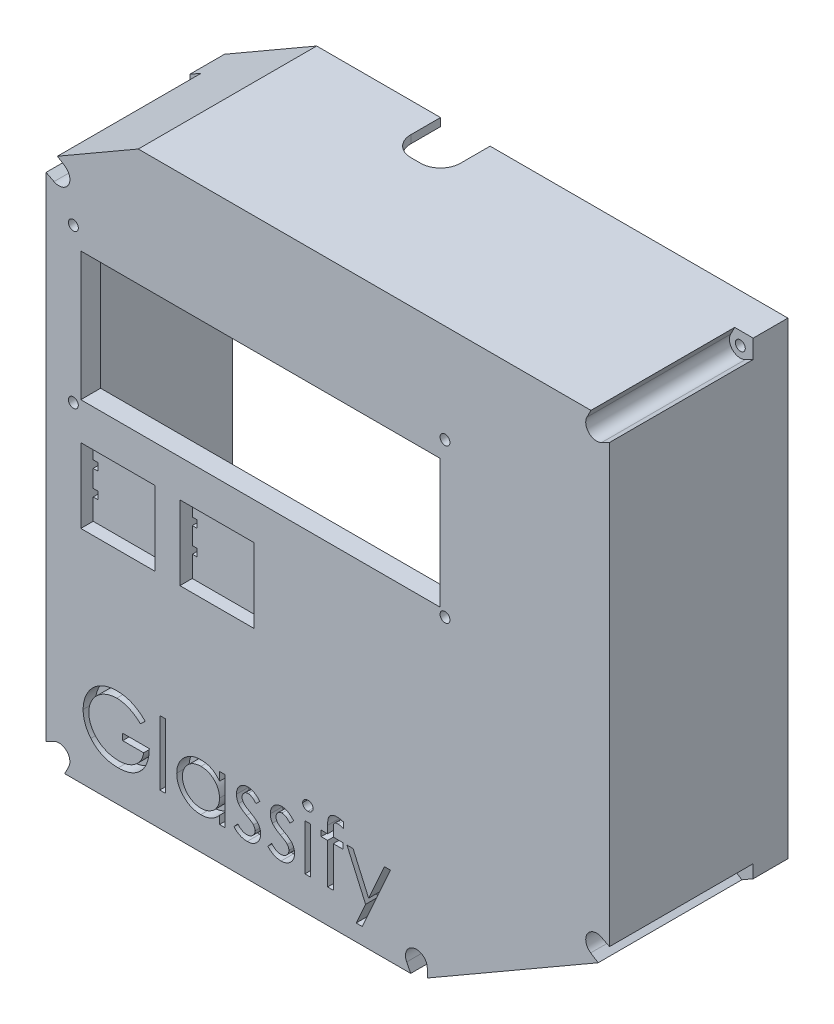
from build123d import *

# Parameters (mm, degrees)
SKETCH1_R                = 1
BOSS_EXTRUDE1_DEPTH      = 32
BOSS_EXTRUDE2_DEPTH      = 4
SKETCH4_W                = 72.5
SKETCH4_H                = 26
CUT_EXTRUDE1_DEPTH       = 4
SKETCH5_R                = 1
CUT_EXTRUDE2_DEPTH       = 4
FILLET2_SIZE             = 30
FILLET2_SIZE_2           = 2.5
CUT_EXTRUDE4_START       = -29
SKETCH8_R                = 1
CUT_EXTRUDE4_DEPTH       = 29
SKETCH8_4_W              = 1.13974359
SKETCH8_4_H              = 13.025641026
SKETCH8_4_H_2            = 9.280769231
CUT_EXTRUDE11_DEPTH      = 2.5
SKETCH9_W                = 15
SKETCH9_H                = 15
CUT_EXTRUDE6_DEPTH       = 2.5
CUT_EXTRUDE7_DEPTH       = 296.947520815
CUT_EXTRUDE7_DEPTH_BACK  = 296.947520815
SKETCH10_W               = 1
SKETCH10_H               = 1.5
CUT_EXTRUDE8_DEPTH       = 312.024520878
CUT_EXTRUDE8_DEPTH_BACK  = 1.6
CUT_EXTRUDE9_DEPTH       = 1.6
CUT_EXTRUDE10_DEPTH      = 1.6
CUT_EXTRUDE12_DEPTH      = 297.240924042
CUT_EXTRUDE12_DEPTH_BACK = 297.240924042
SKETCH14_R               = 1


with BuildPart() as part:
    # Sketch1 → Boss-Extrude1 (new body)
    with BuildSketch(Plane.XY):
        Polygon((62.85, 287.25), (-32.25, 287.25), (-50.85, 276.511284993), (-50.85, 170.65), (24.571677153, 170.65), (62.85, 192.75), align=None)
        with Locations((-48.25, 173.25)):
            Circle(SKETCH1_R, mode=Mode.SUBTRACT)
        with Locations((-48.25, 275.010174293)):
            Circle(SKETCH1_R, mode=Mode.SUBTRACT)
        with Locations((60.25, 194.2511107)):
            Circle(SKETCH1_R, mode=Mode.SUBTRACT)
        with Locations((60.25, 284.65)):
            Circle(SKETCH1_R, mode=Mode.SUBTRACT)
        with Locations((23.875009252, 173.25)):
            Circle(SKETCH1_R, mode=Mode.SUBTRACT)
        with BuildLine():
            Line((-33.750388375, 284.536229507), (-31.821281292, 285.65))
            Line((-31.821281292, 285.65), (-29.593740305, 285.65))
            Line((-29.593740305, 285.65), (58.290408206, 285.65))
            ThreePointArc((58.290408206, 285.65), (58.694365081, 283.094365081), (61.25, 282.690408206))
            Line((61.25, 282.690408206), (61.25, 196.210702494))
            ThreePointArc((61.25, 196.210702494), (58.344744112, 195.3511107), (59.052943725, 192.405289399))
            Line((59.052943725, 192.405289399), (26.072065527, 173.363770493))
            ThreePointArc((26.072065527, 173.363770493), (23.305607353, 175.375036818), (21.915417458, 172.25))
            Line((21.915417458, 172.25), (-46.290408206, 172.25))
            ThreePointArc((-46.290408206, 172.25), (-46.694365081, 174.805634919), (-49.25, 175.209591794))
            Line((-49.25, 175.209591794), (-49.25, 273.050582499))
            ThreePointArc((-49.25, 273.050582499), (-46.344744112, 273.910174293), (-47.052943725, 276.855995594))
            Line((-47.052943725, 276.855995594), (-33.750388375, 284.536229507))
        make_face(mode=Mode.SUBTRACT)
    extrude(amount=BOSS_EXTRUDE1_DEPTH)

    # Sketch2 → Boss-Extrude2 (add)
    with BuildSketch(Plane.XY.offset(32)):
        Polygon((24.571677153, 170.65), (62.85, 192.75), (62.85, 287.25), (-32.25, 287.25), (-50.85, 276.511284993), (-50.85, 170.65), align=None)
    extrude(amount=BOSS_EXTRUDE2_DEPTH)

    # Sketch4 → Cut-Extrude1 (cut)
    with BuildSketch(Plane(origin=(0, 0, 32), x_dir=(-1, 0, 0), z_dir=(0, 0, -1))):
        with Locations((7.6, 250.634259992)):
            Rectangle(SKETCH4_W, SKETCH4_H)
    extrude(amount=-CUT_EXTRUDE1_DEPTH, mode=Mode.SUBTRACT)

    # Sketch5 → Cut-Extrude2 (cut)
    with BuildSketch(Plane(origin=(0, 0, 32), x_dir=(-1, 0, 0), z_dir=(0, 0, -1))):
        with Locations((45.35, 267.384259992)):
            Circle(SKETCH5_R)
        with Locations((45.35, 236.384259992)):
            Circle(SKETCH5_R)
        with Locations((-29.65, 267.384259992)):
            Circle(SKETCH5_R)
        with Locations((-29.65, 236.384259992)):
            Circle(SKETCH5_R)
    extrude(amount=-CUT_EXTRUDE2_DEPTH, mode=Mode.SUBTRACT)

    # Fillet2
    # an asymmetric fillet: 30, 2.5 mm, written as the material it adds along each edge
    with BuildSketch(Plane(origin=(60.25, 284.65, 32), x_dir=(0.7048818539423529, 0.7093247295722822, 0), z_dir=(0.7093247295722822, -0.7048818539423529, 0))) as fillet2_piece_1_section:
        with BuildLine():
            Bezier((2.2, -FILLET2_SIZE), (2.2, 0), (2.2 + FILLET2_SIZE_2, 0), weights=[1, 0.707106781, 1])
            Line((2.2 + FILLET2_SIZE_2, 0), (2.2, 0))
            Line((2.2, 0), (2.2, -FILLET2_SIZE))
        make_face()
    fillet2_piece_1 = revolve(axis=Axis((60.25, 284.65, 32), (0, 0, 1)), revolution_arc=359.64, mode=Mode.PRIVATE)
    fillet2_piece_1 = split(fillet2_piece_1, bisect_by=Plane(origin=(58.672903234, 285.65, 25.67208435), z_dir=(0, -1, 0)), keep=Keep.TOP, mode=Mode.PRIVATE)
    fillet2_piece_1 = split(fillet2_piece_1, bisect_by=Plane(origin=(61.25, 283.072893763, 25.67208435), z_dir=(-1, 0, 0)), keep=Keep.TOP, mode=Mode.PRIVATE)
    add(fillet2_piece_1)
    with BuildSketch(Plane(origin=(23.875009252, 173.25, 32), x_dir=(0.2618523083709333, -0.9651079569668948, 0), z_dir=(-0.9651079569668948, -0.2618523083709333, 0))) as fillet2_piece_2_section:
        with BuildLine():
            Bezier((2.2, -FILLET2_SIZE), (2.2, 0), (2.2 + FILLET2_SIZE_2, 0), weights=[1, 0.707106781, 1])
            Line((2.2 + FILLET2_SIZE_2, 0), (2.2, 0))
            Line((2.2, 0), (2.2, -FILLET2_SIZE))
        make_face()
    fillet2_piece_2 = revolve(axis=Axis((23.875009252, 173.25, 32), (0, 0, 1)), revolution_arc=359.64, mode=Mode.PRIVATE)
    fillet2_piece_2 = split(fillet2_piece_2, bisect_by=Plane(origin=(23.129772547, 172.25, 23.217608396), z_dir=(0, 1, 0)), keep=Keep.TOP, mode=Mode.PRIVATE)
    fillet2_piece_2 = split(fillet2_piece_2, bisect_by=Plane(origin=(25.020403171, 172.756592949, 23.217608396), z_dir=(-0.500000000000001, 0.8660254037844382, 0)), keep=Keep.TOP, mode=Mode.PRIVATE)
    add(fillet2_piece_2)
    with BuildSketch(Plane(origin=(60.25, 194.2511107, 32), x_dir=(0.867591923866824, -0.49727683802994777, 0), z_dir=(-0.49727683802994777, -0.867591923866824, 0))) as fillet2_piece_3_section:
        with BuildLine():
            Bezier((2.2, -FILLET2_SIZE), (2.2, 0), (2.2 + FILLET2_SIZE_2, 0), weights=[1, 0.707106781, 1])
            Line((2.2 + FILLET2_SIZE_2, 0), (2.2, 0))
            Line((2.2, 0), (2.2, -FILLET2_SIZE))
        make_face()
    fillet2_piece_3 = revolve(axis=Axis((60.25, 194.2511107, 32), (0, 0, 1)), revolution_arc=359.64, mode=Mode.PRIVATE)
    fillet2_piece_3 = split(fillet2_piece_3, bisect_by=Plane(origin=(61.25, 195.692247899, 23.217366656), z_dir=(-1, 0, 0)), keep=Keep.TOP, mode=Mode.PRIVATE)
    fillet2_piece_3 = split(fillet2_piece_3, bisect_by=Plane(origin=(59.501938575, 192.664516696, 23.217366656), z_dir=(-0.500000000000001, 0.8660254037844382, 0)), keep=Keep.TOP, mode=Mode.PRIVATE)
    add(fillet2_piece_3)
    with BuildSketch(Plane(origin=(-48.25, 173.25, 32), x_dir=(-0.7048818539423642, -0.7093247295722711, 0), z_dir=(-0.7093247295722711, 0.7048818539423642, 0))) as fillet2_piece_4_section:
        with BuildLine():
            Bezier((2.2, -FILLET2_SIZE), (2.2, 0), (2.2 + FILLET2_SIZE_2, 0), weights=[1, 0.707106781, 1])
            Line((2.2 + FILLET2_SIZE_2, 0), (2.2, 0))
            Line((2.2, 0), (2.2, -FILLET2_SIZE))
        make_face()
    fillet2_piece_4 = revolve(axis=Axis((-48.25, 173.25, 32), (0, 0, 1)), revolution_arc=359.64, mode=Mode.PRIVATE)
    fillet2_piece_4 = split(fillet2_piece_4, bisect_by=Plane(origin=(-46.672903234, 172.25, 25.67208435), z_dir=(0, 1, 0)), keep=Keep.TOP, mode=Mode.PRIVATE)
    fillet2_piece_4 = split(fillet2_piece_4, bisect_by=Plane(origin=(-49.25, 174.827106237, 25.67208435), z_dir=(1, 0, 0)), keep=Keep.TOP, mode=Mode.PRIVATE)
    add(fillet2_piece_4)
    with BuildSketch(Plane(origin=(-48.25, 275.010174293, 32), x_dir=(-0.8675919238668233, 0.49727683802994915, 0), z_dir=(0.49727683802994915, 0.8675919238668233, 0))) as fillet2_piece_5_section:
        with BuildLine():
            Bezier((2.2, -FILLET2_SIZE), (2.2, 0), (2.2 + FILLET2_SIZE_2, 0), weights=[1, 0.707106781, 1])
            Line((2.2 + FILLET2_SIZE_2, 0), (2.2, 0))
            Line((2.2, 0), (2.2, -FILLET2_SIZE))
        make_face()
    fillet2_piece_5 = revolve(axis=Axis((-48.25, 275.010174293, 32), (0, 0, 1)), revolution_arc=359.64, mode=Mode.PRIVATE)
    fillet2_piece_5 = split(fillet2_piece_5, bisect_by=Plane(origin=(-49.25, 273.569037094, 23.217366656), z_dir=(1, 0, 0)), keep=Keep.TOP, mode=Mode.PRIVATE)
    fillet2_piece_5 = split(fillet2_piece_5, bisect_by=Plane(origin=(-47.501938575, 276.596768297, 23.217366656), z_dir=(0.5000000000000029, -0.866025403784437, 0)), keep=Keep.TOP, mode=Mode.PRIVATE)
    add(fillet2_piece_5)

    # Sketch8 → Cut-Extrude4 (cut)
    # profile 1 of 5: a face of its own
    with BuildSketch(Plane.XY.offset(36).offset(CUT_EXTRUDE4_START)):
        with BuildLine():
            Line((26.164958746, 171.569881557), (26.072065527, 173.363770493))
            ThreePointArc((26.072065527, 173.363770493), (23.305607353, 175.375036818), (21.915417458, 172.25))
            Line((21.915417458, 172.25), (22.731914039, 170.65))
            Line((22.731914039, 170.65), (24.571677153, 170.65))
            Line((24.571677153, 170.65), (26.164958746, 171.569881557))
        make_face()
        with Locations((23.875009252, 173.25)):
            Circle(SKETCH8_R, mode=Mode.SUBTRACT)
    # profile 2 of 5: a face of its own
    with BuildSketch(Plane.XY.offset(36).offset(CUT_EXTRUDE4_START)):
        with BuildLine():
            ThreePointArc((-49.25, 273.050582499), (-46.344744112, 273.910174293), (-47.052943725, 276.855995594))
            Line((-47.052943725, 276.855995594), (-48.560050506, 277.83338795))
            Line((-48.560050506, 277.83338795), (-50.85, 276.511284993))
            Line((-50.85, 276.511284993), (-50.85, 273.86707908))
            Line((-50.85, 273.86707908), (-49.25, 273.050582499))
        make_face()
        with Locations((-48.25, 275.010174293)):
            Circle(SKETCH8_R, mode=Mode.SUBTRACT)
    # profile 3 of 5: a face of its own
    with BuildSketch(Plane.XY.offset(36).offset(CUT_EXTRUDE4_START)):
        with BuildLine():
            Line((62.85, 195.394205913), (61.25, 196.210702494))
            ThreePointArc((61.25, 196.210702494), (58.344744112, 195.3511107), (59.052943725, 192.405289399))
            Line((59.052943725, 192.405289399), (60.560050506, 191.427897043))
            Line((60.560050506, 191.427897043), (62.85, 192.75))
            Line((62.85, 192.75), (62.85, 195.394205913))
        make_face()
        with Locations((60.25, 194.2511107)):
            Circle(SKETCH8_R, mode=Mode.SUBTRACT)
    # profile 4 of 5: a face of its own
    with BuildSketch(Plane.XY.offset(36).offset(CUT_EXTRUDE4_START)):
        with BuildLine():
            Line((-47.106904787, 170.65), (-50.85, 170.65))
            Line((-50.85, 170.65), (-50.85, 174.393095213))
            Line((-50.85, 174.393095213), (-49.25, 175.209591794))
            ThreePointArc((-49.25, 175.209591794), (-46.694365081, 174.805634919), (-46.290408206, 172.25))
            Line((-46.290408206, 172.25), (-47.106904787, 170.65))
        make_face()
    # profile 5 of 5: a face of its own
    with BuildSketch(Plane.XY.offset(36).offset(CUT_EXTRUDE4_START)):
        with BuildLine():
            Line((62.85, 287.25), (62.85, 283.506904787))
            Line((62.85, 283.506904787), (61.25, 282.690408206))
            ThreePointArc((61.25, 282.690408206), (58.694365081, 283.094365081), (58.290408206, 285.65))
            Line((58.290408206, 285.65), (59.106904787, 287.25))
            Line((59.106904787, 287.25), (62.85, 287.25))
        make_face()
    extrude(amount=CUT_EXTRUDE4_DEPTH, mode=Mode.SUBTRACT)


with BuildPart() as cut_extrude4_piece_1:
    # of the separate pieces the step leaves, piece 1, a body of its own (cut_extrude4_pieces)
    add(part.part.solids().sort_by_distance((-49.25, 273.050582499, 2))[0])

    # Sketch8<4> → Cut-Extrude11 (cut)
    # profile 1 of 9: a face of its own
    with BuildSketch(Plane.XY.offset(36)):
        with BuildLine():
            Line((-31.814392065, 186.988858523), (-30.837468988, 187.914900189))
            add(Edge.make_bspline(
                [(-36.543819148, 190.408089292), (-36.412326092, 190.405986565), (-36.151590815, 190.401817104), (-35.763603158, 190.372916809), (-35.381612505, 190.327110155), (-35.005052461, 190.26460153), (-34.635205361, 190.179461853), (-34.271017601, 190.077577791), (-33.911961256, 189.958953178), (-33.559161609, 189.817479364), (-33.210246468, 189.656901925), (-32.863275789, 189.476150364), (-32.519435097, 189.272133918), (-32.178128107, 189.044246804), (-31.837202566, 188.796402973), (-31.502050863, 188.521513927), (-31.164583037, 188.230419927), (-30.947587883, 188.021116003), (-30.837468988, 187.914900189)],
                knots=[0, 0, 0, 0, 0.985871117, 1.954866573, 2.915460327, 3.869826059, 4.81536089, 5.759505086, 6.70452669, 7.649098992, 8.607881297, 9.583363685, 10.581137262, 11.603961102, 12.659522466, 13.73993555, 14.853081303, 16, 16, 16, 16], degree=3))
            add(Edge.make_bspline(
                [(-43.374648475, 183.737536407), (-43.372717211, 183.886911096), (-43.368879228, 184.183762011), (-43.322340926, 184.624478527), (-43.255570067, 185.05736961), (-43.157427897, 185.4820814), (-43.033707165, 185.898897547), (-42.879298802, 186.308011587), (-42.699521608, 186.70966495), (-42.490568522, 187.101092985), (-42.258033483, 187.477101569), (-42.005665541, 187.836177027), (-41.729881048, 188.171780206), (-41.435183719, 188.488161329), (-41.118057497, 188.781345717), (-40.781473302, 189.054047776), (-40.425171744, 189.306633307), (-40.048031891, 189.53512385), (-39.655682865, 189.740368987), (-39.249065145, 189.920306984), (-38.828302857, 190.069017872), (-38.396548295, 190.195197015), (-37.950533364, 190.288506239), (-37.493494702, 190.356174544), (-37.02305001, 190.402477291), (-36.705056418, 190.406201134), (-36.543819148, 190.408089292)],
                knots=[0, 0, 0, 0, 1.008945113, 2.00506715, 2.99143336, 3.967273523, 4.948097931, 5.927297278, 6.919902385, 7.919676788, 8.923139349, 9.905703106, 10.883022732, 11.856032218, 12.825136022, 13.798837087, 14.781400844, 15.773989409, 16.776158564, 17.77167057, 18.775803737, 19.789618931, 20.80898985, 21.851988756, 22.910860228, 24, 24, 24, 24], degree=3))
            add(Edge.make_bspline(
                [(-41.817677321, 179.458409805), (-41.941723417, 179.613243317), (-42.187756571, 179.920340265), (-42.504451597, 180.412374349), (-42.774422401, 180.921832528), (-42.993471356, 181.450133036), (-43.164515269, 181.996781723), (-43.287183672, 182.561080065), (-43.359055836, 183.143754725), (-43.3694101, 183.538054399), (-43.374648475, 183.737536407)],
                knots=[0, 0, 0, 0, 1.023165419, 2.029347347, 3.013907458, 3.994755782, 4.975994455, 5.96558838, 6.970761222, 8, 8, 8, 8], degree=3))
            add(Edge.make_bspline(
                [(-36.314852802, 177.056807241), (-36.45821815, 177.058872338), (-36.740980823, 177.062945375), (-37.158596476, 177.09189175), (-37.564697556, 177.136452698), (-37.959224903, 177.203745003), (-38.343629745, 177.286166748), (-38.715992238, 177.391709985), (-39.077730845, 177.513879265), (-39.429404679, 177.652837852), (-39.767821749, 177.813843578), (-40.094489396, 177.992767127), (-40.411213338, 178.188685893), (-40.715836137, 178.404988104), (-41.009944992, 178.640055888), (-41.291643487, 178.894360394), (-41.562508645, 179.167124172), (-41.732182327, 179.360813721), (-41.817677321, 179.458409805)],
                knots=[0, 0, 0, 0, 1.107784379, 2.184907829, 3.233506516, 4.263428166, 5.276301166, 6.270063455, 7.25232949, 8.225834625, 9.190232166, 10.146266622, 11.1027726, 12.066435141, 13.031522626, 14.010570082, 14.99756817, 16, 16, 16, 16], degree=3))
            add(Edge.make_bspline(
                [(-30.023366423, 183.569627754), (-30.029556216, 183.326849151), (-30.041670759, 182.851687571), (-30.126647967, 182.158738303), (-30.263867883, 181.50424673), (-30.451321014, 180.887523584), (-30.693982746, 180.309442833), (-30.989248778, 179.769417547), (-31.34184476, 179.270936448), (-31.739211219, 178.809930064), (-32.185162494, 178.398706923), (-32.66764863, 178.037279662), (-33.187466772, 177.732833029), (-33.744125216, 177.48514434), (-34.335801646, 177.291835844), (-34.963865196, 177.15477898), (-35.627464147, 177.072664542), (-36.082257231, 177.062172965), (-36.314852802, 177.056807241)],
                knots=[0, 0, 0, 0, 1.140356446, 2.231883559, 3.274166699, 4.278491846, 5.25512956, 6.21435461, 7.1637429, 8.11826594, 9.068280886, 10.0076534, 10.945064095, 11.891975133, 12.864533718, 13.863980011, 14.907571808, 16, 16, 16, 16], degree=3))
            Line((-30.023366423, 183.569627754), (-35.396443347, 183.569627754))
            Line((-35.396443347, 183.569627754), (-35.396443347, 182.267063651))
            Line((-35.396443347, 182.267063651), (-31.163110013, 182.267063651))
            add(Edge.make_bspline(
                [(-36.215634052, 178.359371343), (-36.050975477, 178.36281332), (-35.727641615, 178.369572201), (-35.252347952, 178.422187537), (-34.795862524, 178.504363045), (-34.359468015, 178.62470787), (-33.942657568, 178.778209777), (-33.543903181, 178.963250179), (-33.166344305, 179.186926422), (-32.808845933, 179.439380168), (-32.479527003, 179.720648275), (-32.182513467, 180.024158155), (-31.922542692, 180.348436568), (-31.695739926, 180.691573569), (-31.50811138, 181.05640939), (-31.354104666, 181.441156117), (-31.236055294, 181.845986803), (-31.187595814, 182.125719296), (-31.163110013, 182.267063651)],
                knots=[0, 0, 0, 0, 1.13008108, 2.219097802, 3.278683437, 4.311054135, 5.322181354, 6.324827112, 7.324222904, 8.330512327, 9.32562643, 10.293043162, 11.24128371, 12.174520618, 13.111833804, 14.052305215, 15.015860969, 16, 16, 16, 16], degree=3))
            add(Edge.make_bspline(
                [(-42.234904885, 183.788417818), (-42.232162707, 183.671320852), (-42.22668584, 183.437446674), (-42.19163268, 183.088399611), (-42.126578779, 182.744536579), (-42.039610236, 182.404727639), (-41.930822705, 182.068390826), (-41.795213316, 181.73698429), (-41.634592423, 181.410520299), (-41.448676934, 181.091940375), (-41.244801281, 180.781613976), (-41.016407816, 180.489297997), (-40.773799413, 180.211099862), (-40.508137548, 179.953196376), (-40.227940924, 179.708689095), (-39.924838093, 179.484314487), (-39.604789165, 179.275750648), (-39.267305854, 179.085626135), (-38.916050043, 178.91577802), (-38.555889825, 178.76474274), (-38.185674608, 178.640357716), (-37.807349992, 178.53898231), (-37.421366977, 178.455886946), (-37.025766322, 178.402429089), (-36.62345678, 178.363636645), (-36.352262315, 178.360800299), (-36.215634052, 178.359371343)],
                knots=[0, 0, 0, 0, 0.93586088, 1.869166235, 2.799637598, 3.729985548, 4.670839027, 5.622275134, 6.589130586, 7.576015415, 8.568469353, 9.55398029, 10.53834874, 11.515998671, 12.510579167, 13.508179873, 14.527009472, 15.561807829, 16.601455013, 17.643573243, 18.680854198, 19.719860599, 20.772568776, 21.833555941, 22.908541556, 24, 24, 24, 24], degree=3))
            add(Edge.make_bspline(
                [(-36.581980206, 189.105525189), (-36.705042117, 189.104024391), (-36.950846773, 189.101026686), (-37.315960684, 189.062766248), (-37.677245338, 189.007739456), (-38.034018727, 188.928121785), (-38.386974537, 188.827214626), (-38.734885203, 188.700993088), (-39.078399719, 188.553835488), (-39.414282356, 188.383791654), (-39.739912183, 188.196993355), (-40.047458415, 187.98998865), (-40.33888132, 187.769412184), (-40.608703434, 187.529741487), (-40.858476826, 187.273147547), (-41.094146633, 187.004403551), (-41.307424249, 186.716167186), (-41.500069334, 186.413741629), (-41.671924349, 186.102438542), (-41.823630035, 185.785254265), (-41.950982326, 185.463240851), (-42.051745778, 185.135994226), (-42.134878722, 184.806046085), (-42.193362611, 184.471111814), (-42.226334431, 184.130832784), (-42.232037747, 183.902968447), (-42.234904885, 183.788417818)],
                knots=[0, 0, 0, 0, 1.02818874, 2.053710826, 3.065248034, 4.081641283, 5.106893873, 6.131558223, 7.173050175, 8.228653731, 9.27666206, 10.308777013, 11.325269123, 12.329503258, 13.32196095, 14.316845687, 15.314881793, 16.315733098, 17.311955233, 18.285320748, 19.252783886, 20.203351036, 21.145449891, 22.095197417, 23.042428769, 24, 24, 24, 24], degree=3))
            add(Edge.make_bspline(
                [(-31.814392065, 186.988858523), (-31.99117203, 187.155159083), (-32.340516542, 187.483794671), (-32.910057993, 187.910191711), (-33.504286037, 188.275465846), (-34.120099954, 188.572668475), (-34.742249564, 188.809805634), (-35.362476838, 188.978636315), (-35.974419811, 189.086305236), (-36.381426575, 189.099180748), (-36.581980206, 189.105525189)],
                knots=[0, 0, 0, 0, 1.08915593, 2.152340314, 3.188132944, 4.216796309, 5.218260357, 6.173443236, 7.099959455, 8, 8, 8, 8], degree=3))
        make_face()
    # profile 2 of 9: a face of its own
    with BuildSketch(Plane.XY.offset(36)):
        with Locations((-27.336827962, 183.895268779)):
            Rectangle(SKETCH8_4_W, SKETCH8_4_H)
    # profile 3 of 9: a face of its own
    with BuildSketch(Plane.XY.offset(36)):
        with BuildLine():
            Line((-14.718238218, 177.382448266), (-14.718238218, 186.663217497))
            Line((-14.718238218, 186.663217497), (-15.857981808, 186.663217497))
            Line((-15.857981808, 186.663217497), (-15.857981808, 184.945969901))
            add(Edge.make_bspline(
                [(-19.613029885, 186.82603801), (-19.423618968, 186.820821026), (-19.052193099, 186.810590766), (-18.508894322, 186.725454584), (-17.994927217, 186.581623575), (-17.506324282, 186.385980082), (-17.044840078, 186.125997551), (-16.614843535, 185.798047406), (-16.211834496, 185.404197956), (-15.978226009, 185.101682344), (-15.857981808, 184.945969901)],
                knots=[0, 0, 0, 0, 1.038897134, 2.037228247, 3.008116434, 3.962042015, 4.918381754, 5.904844433, 6.921570401, 8, 8, 8, 8], degree=3))
            add(Edge.make_bspline(
                [(-24.487468988, 182.048273587), (-24.482922491, 182.209613311), (-24.473934314, 182.528573243), (-24.406975487, 182.997670233), (-24.294377256, 183.449493636), (-24.13636078, 183.88258883), (-23.933734258, 184.297479869), (-23.687252342, 184.694460188), (-23.396897233, 185.07462343), (-23.062152784, 185.429030453), (-22.699532333, 185.756402397), (-22.311606366, 186.040915219), (-21.908024745, 186.286630642), (-21.482527536, 186.481316113), (-21.041412612, 186.638829149), (-20.580752966, 186.747805919), (-20.102465238, 186.812021913), (-19.777742595, 186.821321086), (-19.613029885, 186.82603801)],
                knots=[0, 0, 0, 0, 1.020392517, 2.01726096, 2.990465484, 3.961182959, 4.928053699, 5.906110375, 6.912531644, 7.948652711, 8.985773172, 9.998621852, 10.987621588, 11.969261332, 12.953316658, 13.946091881, 14.958173133, 16, 16, 16, 16], degree=3))
            add(Edge.make_bspline(
                [(-19.648646872, 177.219627754), (-19.812542019, 177.224077733), (-20.135750505, 177.232853289), (-20.611198871, 177.300933648), (-21.068733605, 177.410264761), (-21.508787054, 177.562305131), (-21.928511696, 177.763984113), (-22.33150119, 178.005433784), (-22.715667815, 178.292964796), (-23.075155971, 178.621669928), (-23.406197801, 178.978703167), (-23.696705847, 179.35950558), (-23.938924165, 179.762430511), (-24.141471315, 180.182376527), (-24.297486622, 180.622576378), (-24.406248095, 181.081507815), (-24.474249145, 181.558628214), (-24.483021073, 181.883528769), (-24.487468988, 182.048273587)],
                knots=[0, 0, 0, 0, 1.033919861, 2.038935746, 3.024066025, 3.998881131, 4.97069526, 5.957263378, 6.95902576, 7.993208707, 9.027059324, 10.027763471, 11.009749337, 11.988697705, 12.965288445, 13.950418724, 14.960734635, 16, 16, 16, 16], degree=3))
            add(Edge.make_bspline(
                [(-15.857981808, 178.98775676), (-15.98650142, 178.842470233), (-16.237309058, 178.55894175), (-16.6561954, 178.188529295), (-17.100217075, 177.882356528), (-17.567219011, 177.635069691), (-18.056779494, 177.449315658), (-18.567813297, 177.317285881), (-19.100528879, 177.232399679), (-19.464301709, 177.223923257), (-19.648646872, 177.219627754)],
                knots=[0, 0, 0, 0, 1.074387032, 2.096679803, 3.090159297, 4.057316773, 5.018401886, 5.985159533, 6.978961417, 8, 8, 8, 8], degree=3))
            Line((-15.857981808, 178.98775676), (-15.857981808, 177.382448266))
            Line((-15.857981808, 177.382448266), (-14.718238218, 177.382448266))
        make_face()
        with BuildLine():
            add(Edge.make_bspline(
                [(-19.597765462, 185.68629442), (-19.764368917, 185.680366649), (-20.093217636, 185.668666172), (-20.575977301, 185.577322346), (-21.037943118, 185.425341104), (-21.476804587, 185.217489634), (-21.885629259, 184.956128218), (-22.251003436, 184.640002056), (-22.575915524, 184.277736319), (-22.84917694, 183.870965804), (-23.071936743, 183.434891016), (-23.228571402, 182.979053769), (-23.331874099, 182.511675708), (-23.342427874, 182.194673963), (-23.347725398, 182.035553234)],
                knots=[0, 0, 0, 0, 1.031046209, 2.035121221, 3.029706178, 4.034933723, 5.034054252, 6.02443088, 7.017295772, 8.038157696, 9.050218397, 10.03989886, 11.016116709, 12, 12, 12, 12], degree=3))
            add(Edge.make_bspline(
                [(-15.857981808, 182.002480318), (-15.86146399, 182.13070616), (-15.868318025, 182.383095195), (-15.920680378, 182.753672187), (-16.003973968, 183.108305993), (-16.121344356, 183.447369465), (-16.275527017, 183.768987949), (-16.461483196, 184.075470736), (-16.68248297, 184.365223818), (-16.934968753, 184.634257247), (-17.211339631, 184.879644696), (-17.503782679, 185.098680655), (-17.815762703, 185.278617059), (-18.142033095, 185.427538244), (-18.483159937, 185.546044302), (-18.841919043, 185.625102505), (-19.214497081, 185.679387099), (-19.468664196, 185.683967737), (-19.597765462, 185.68629442)],
                knots=[0, 0, 0, 0, 1.050140795, 2.067009409, 3.05949893, 4.030605086, 5.00011959, 5.97591094, 6.962425594, 7.979863591, 8.993523472, 9.986985069, 10.967611495, 11.937549037, 12.921786183, 13.919465291, 14.943216303, 16, 16, 16, 16], degree=3))
            add(Edge.make_bspline(
                [(-19.607941744, 178.359371343), (-19.443035863, 178.365394641), (-19.11505442, 178.377374383), (-18.630862537, 178.46910926), (-18.160980815, 178.620670328), (-17.711810015, 178.830761445), (-17.293377196, 179.091138136), (-16.917827754, 179.395963867), (-16.600269812, 179.750486849), (-16.331056629, 180.140109979), (-16.119962974, 180.567236366), (-15.966198416, 181.022020429), (-15.87528853, 181.504478001), (-15.863830482, 181.83418425), (-15.857981808, 182.002480318)],
                knots=[0, 0, 0, 0, 1.01762866, 2.023962475, 3.030623092, 4.058876274, 5.077231937, 6.066672613, 7.034107872, 8.005628644, 8.981990164, 9.965428785, 10.961468474, 12, 12, 12, 12], degree=3))
            add(Edge.make_bspline(
                [(-23.347725398, 182.035553234), (-23.340958499, 181.877383417), (-23.327451226, 181.561663754), (-23.230384421, 181.093648518), (-23.067534594, 180.637703851), (-22.845313395, 180.197699675), (-22.5670505, 179.789180225), (-22.244511675, 179.420008923), (-21.874577797, 179.102546703), (-21.464812271, 178.836798936), (-21.027177636, 178.622123503), (-20.566951656, 178.47275104), (-20.092785769, 178.376311664), (-19.770378729, 178.365046848), (-19.607941744, 178.359371343)],
                knots=[0, 0, 0, 0, 0.979072187, 1.954306742, 2.945804271, 3.96968567, 4.997920485, 5.998718438, 6.996577872, 8.005894225, 9.015743152, 10.005417472, 10.995077863, 12, 12, 12, 12], degree=3))
        make_face(mode=Mode.SUBTRACT)
    # profile 4 of 9: a face of its own
    with BuildSketch(Plane.XY.offset(36)):
        with BuildLine():
            Line((-8.490353603, 184.709371343), (-7.716956167, 185.505665414))
            add(Edge.make_bspline(
                [(-10.093118026, 186.82603801), (-9.994449681, 186.822030831), (-9.795262077, 186.813941302), (-9.496432434, 186.749694939), (-9.198042878, 186.64398339), (-8.899326722, 186.497983343), (-8.602472244, 186.309054965), (-8.304868221, 186.080711507), (-8.00294194, 185.814455229), (-7.814414746, 185.610895182), (-7.716956167, 185.505665414)],
                knots=[0, 0, 0, 0, 0.845714091, 1.707292901, 2.609013841, 3.555613372, 4.552488639, 5.621697636, 6.770543573, 8, 8, 8, 8], degree=3))
            add(Edge.make_bspline(
                [(-12.438751039, 184.391362529), (-12.436812673, 184.477088973), (-12.433019016, 184.64486777), (-12.402742029, 184.891388632), (-12.34761782, 185.125606219), (-12.278475672, 185.351037979), (-12.182380199, 185.563317006), (-12.067550772, 185.765274115), (-11.932613544, 185.95663016), (-11.777153603, 186.134441525), (-11.606223776, 186.295946795), (-11.421548469, 186.436730388), (-11.227281081, 186.556859161), (-11.022599101, 186.657607029), (-10.805536242, 186.733812046), (-10.577609754, 186.786271701), (-10.339280992, 186.821306294), (-10.17635405, 186.824438057), (-10.093118026, 186.82603801)],
                knots=[0, 0, 0, 0, 1.087655834, 2.128696564, 3.144119009, 4.137814668, 5.115653402, 6.093965665, 7.082169637, 8.081268856, 9.086088321, 10.061021666, 11.022561449, 11.980240094, 12.950172527, 13.934149372, 14.944599409, 16, 16, 16, 16], degree=3))
            add(Edge.make_bspline(
                [(-12.013891263, 182.961594901), (-12.079679439, 183.067351847), (-12.211278781, 183.278902697), (-12.339059618, 183.632000712), (-12.426892923, 184.00372992), (-12.43473931, 184.26022222), (-12.438751039, 184.391362529)],
                knots=[0, 0, 0, 0, 0.985009483, 1.970363186, 2.962279964, 4, 4, 4, 4], degree=3))
            add(Edge.make_bspline(
                [(-10.413670911, 181.694647786), (-10.508183005, 181.747404063), (-10.691472117, 181.849715322), (-10.951086573, 182.009067956), (-11.185301258, 182.171146353), (-11.399751914, 182.326858656), (-11.589021849, 182.484414652), (-11.752365433, 182.64398925), (-11.896213673, 182.799146914), (-11.975851424, 182.909082819), (-12.013891263, 182.961594901)],
                knots=[0, 0, 0, 0, 1.262093308, 2.447601706, 3.550203992, 4.582594899, 5.537233252, 6.418365656, 7.244515135, 8, 8, 8, 8], degree=3))
            add(Edge.make_bspline(
                [(-9.006799917, 180.738077273), (-9.035909748, 180.77086273), (-9.099321474, 180.842281296), (-9.215636207, 180.945423725), (-9.354907535, 181.056596256), (-9.518701841, 181.173913736), (-9.707349317, 181.295828675), (-9.921614556, 181.421701468), (-10.158562275, 181.557510644), (-10.326095709, 181.647570536), (-10.413670911, 181.694647786)],
                knots=[0, 0, 0, 0, 0.615000592, 1.339693406, 2.178160186, 3.116406724, 4.166410947, 5.330106347, 6.604359322, 8, 8, 8, 8], degree=3))
            add(Edge.make_bspline(
                [(-8.693879244, 179.852740734), (-8.697820941, 179.933692779), (-8.705603293, 180.093521755), (-8.766720308, 180.324844421), (-8.863286944, 180.544261526), (-8.958372382, 180.672675388), (-9.006799917, 180.738077273)],
                knots=[0, 0, 0, 0, 1.013901739, 2.00181326, 2.98231254, 4, 4, 4, 4], degree=3))
            add(Edge.make_bspline(
                [(-10.332260654, 178.359371343), (-10.222249894, 178.364345479), (-10.007307323, 178.374064106), (-9.699445685, 178.462300412), (-9.415188383, 178.600657666), (-9.168360815, 178.796907856), (-8.958258688, 179.025346648), (-8.806119312, 179.282663595), (-8.710774333, 179.561306881), (-8.699576566, 179.754464093), (-8.693879244, 179.852740734)],
                knots=[0, 0, 0, 0, 1.072336372, 2.095165389, 3.102688358, 4.141489647, 5.156069229, 6.117746104, 7.042326257, 8, 8, 8, 8], degree=3))
            add(Edge.make_bspline(
                [(-12.171623635, 179.33629442), (-12.099878022, 179.258807132), (-11.960788304, 179.108586307), (-11.73835246, 178.908563699), (-11.512004347, 178.740919087), (-11.284004199, 178.600698696), (-11.050976999, 178.492656519), (-10.814228628, 178.416751907), (-10.574240632, 178.367968695), (-10.413051739, 178.362241785), (-10.332260654, 178.359371343)],
                knots=[0, 0, 0, 0, 1.179806542, 2.287233372, 3.337373186, 4.324005949, 5.273901747, 6.200048787, 7.097828587, 8, 8, 8, 8], degree=3))
            Line((-12.171623635, 179.33629442), (-12.927212577, 178.476398587))
            add(Edge.make_bspline(
                [(-10.273747032, 177.219627754), (-10.402079355, 177.223229838), (-10.656960833, 177.230383955), (-11.033932099, 177.29753452), (-11.402307423, 177.402020664), (-11.759299127, 177.546132768), (-12.096923597, 177.728108211), (-12.405827238, 177.946048897), (-12.687083116, 178.192755459), (-12.847169424, 178.381850877), (-12.927212577, 178.476398587)],
                knots=[0, 0, 0, 0, 1.013940152, 2.01379169, 3.017749504, 4.037548394, 5.051665909, 6.043208538, 7.021604269, 8, 8, 8, 8], degree=3))
            add(Edge.make_bspline(
                [(-7.554135654, 179.901078074), (-7.556746534, 179.809387172), (-7.561891558, 179.628700233), (-7.597662258, 179.362599565), (-7.659184601, 179.108111314), (-7.742981937, 178.862474138), (-7.856136661, 178.630394557), (-7.988752954, 178.40601731), (-8.147956205, 178.194196076), (-8.329716339, 177.995208992), (-8.528727132, 177.81346928), (-8.741020834, 177.653725219), (-8.966858876, 177.521012624), (-9.204627556, 177.411192657), (-9.4548671, 177.323859263), (-9.717616636, 177.263398079), (-9.992040974, 177.227211203), (-10.178657706, 177.222187532), (-10.273747032, 177.219627754)],
                knots=[0, 0, 0, 0, 1.032770009, 2.035186124, 3.017557409, 3.978232242, 4.952395191, 5.920591857, 6.910227898, 7.931268572, 8.952309245, 9.941945286, 10.918353717, 11.897095711, 12.887975737, 13.898235213, 14.929059601, 16, 16, 16, 16], degree=3))
            add(Edge.make_bspline(
                [(-7.986627641, 181.335933843), (-7.920549442, 181.228288324), (-7.789041561, 181.014053761), (-7.650944423, 180.661289753), (-7.57089714, 180.28714593), (-7.559785655, 180.031214731), (-7.554135654, 179.901078074)],
                knots=[0, 0, 0, 0, 0.995354457, 1.980940102, 2.973342415, 4, 4, 4, 4], degree=3))
            add(Edge.make_bspline(
                [(-9.658081968, 182.638497946), (-9.55933556, 182.583180727), (-9.368590014, 182.476326075), (-9.097561973, 182.310465151), (-8.851591853, 182.145613983), (-8.628595573, 181.983535589), (-8.432863867, 181.819695184), (-8.258458205, 181.660372751), (-8.109728708, 181.500754404), (-8.026438745, 181.389237106), (-7.986627641, 181.335933843)],
                knots=[0, 0, 0, 0, 1.27191281, 2.456916733, 3.569705269, 4.599008579, 5.553216877, 6.436649441, 7.252746552, 8, 8, 8, 8], degree=3))
            add(Edge.make_bspline(
                [(-10.983542706, 183.595068459), (-10.9546466, 183.559564396), (-10.89314488, 183.483998472), (-10.777725411, 183.379118775), (-10.647015187, 183.263214036), (-10.489825698, 183.147328942), (-10.312929111, 183.025293825), (-10.112489423, 182.901914656), (-9.894867648, 182.7677866), (-9.739066564, 182.682716791), (-9.658081968, 182.638497946)],
                knots=[0, 0, 0, 0, 0.66740084, 1.420478572, 2.27185888, 3.217733974, 4.268547843, 5.408967954, 6.65319498, 8, 8, 8, 8], degree=3))
            add(Edge.make_bspline(
                [(-11.299007449, 184.437155798), (-11.294976787, 184.363814952), (-11.286926827, 184.217340008), (-11.224346019, 184.001265713), (-11.124683414, 183.790601603), (-11.031537281, 183.661559057), (-10.983542706, 183.595068459)],
                knots=[0, 0, 0, 0, 0.960159726, 1.917612774, 2.927026955, 4, 4, 4, 4], degree=3))
            add(Edge.make_bspline(
                [(-10.093118026, 185.68629442), (-10.173452383, 185.682394167), (-10.33153903, 185.67471902), (-10.55805557, 185.59810743), (-10.768333553, 185.480510008), (-10.950331737, 185.313709719), (-11.104501319, 185.1222508), (-11.217036676, 184.908178422), (-11.285856102, 184.677952663), (-11.294581844, 184.518187179), (-11.299007449, 184.437155798)],
                knots=[0, 0, 0, 0, 0.99966794, 1.967205029, 2.953328237, 3.988086729, 5.028030931, 6.008226631, 6.989793394, 8, 8, 8, 8], degree=3))
            add(Edge.make_bspline(
                [(-8.490353603, 184.709371343), (-8.557084859, 184.786707617), (-8.685734864, 184.935802849), (-8.889774809, 185.135145919), (-9.093060456, 185.302557097), (-9.292809008, 185.443898151), (-9.494043299, 185.550756483), (-9.69440183, 185.628752125), (-9.894092053, 185.677018677), (-10.027572809, 185.68323964), (-10.093118026, 185.68629442)],
                knots=[0, 0, 0, 0, 1.26578478, 2.440284043, 3.530471711, 4.527705817, 5.468200915, 6.346673037, 7.188140097, 8, 8, 8, 8], degree=3))
        make_face()
    # profile 5 of 9: a face of its own
    with BuildSketch(Plane.XY.offset(36)):
        with BuildLine():
            Line((-1.651892065, 184.709371343), (-0.878494629, 185.505665414))
            add(Edge.make_bspline(
                [(-3.254656488, 186.82603801), (-3.155988143, 186.822030831), (-2.956800538, 186.813941302), (-2.657970895, 186.749694939), (-2.359581339, 186.64398339), (-2.060865184, 186.497983343), (-1.764010705, 186.309054965), (-1.466406682, 186.080711507), (-1.164480401, 185.814455229), (-0.975953208, 185.610895182), (-0.878494629, 185.505665414)],
                knots=[0, 0, 0, 0, 0.845714091, 1.707292901, 2.609013841, 3.555613372, 4.552488639, 5.621697636, 6.770543573, 8, 8, 8, 8], degree=3))
            add(Edge.make_bspline(
                [(-5.6002895, 184.391362529), (-5.598351135, 184.477088973), (-5.594557478, 184.64486777), (-5.564280491, 184.891388632), (-5.509156282, 185.125606219), (-5.440014134, 185.351037979), (-5.343918661, 185.563317006), (-5.229089233, 185.765274115), (-5.094152006, 185.95663016), (-4.938692065, 186.134441525), (-4.767762238, 186.295946795), (-4.58308693, 186.436730388), (-4.388819542, 186.556859161), (-4.184137563, 186.657607029), (-3.967074704, 186.733812046), (-3.739148216, 186.786271701), (-3.500819454, 186.821306294), (-3.337892511, 186.824438057), (-3.254656488, 186.82603801)],
                knots=[0, 0, 0, 0, 1.087655834, 2.128696564, 3.144119009, 4.137814668, 5.115653402, 6.093965665, 7.082169637, 8.081268856, 9.086088321, 10.061021666, 11.022561449, 11.980240094, 12.950172527, 13.934149372, 14.944599409, 16, 16, 16, 16], degree=3))
            add(Edge.make_bspline(
                [(-5.175429725, 182.961594901), (-5.241217901, 183.067351847), (-5.372817243, 183.278902697), (-5.500598079, 183.632000712), (-5.588431384, 184.00372992), (-5.596277771, 184.26022222), (-5.6002895, 184.391362529)],
                knots=[0, 0, 0, 0, 0.985009483, 1.970363186, 2.962279964, 4, 4, 4, 4], degree=3))
            add(Edge.make_bspline(
                [(-3.575209372, 181.694647786), (-3.669721466, 181.747404063), (-3.853010578, 181.849715322), (-4.112625034, 182.009067956), (-4.346839719, 182.171146353), (-4.561290376, 182.326858656), (-4.750560311, 182.484414652), (-4.913903894, 182.64398925), (-5.057752135, 182.799146914), (-5.137389886, 182.909082819), (-5.175429725, 182.961594901)],
                knots=[0, 0, 0, 0, 1.262093308, 2.447601706, 3.550203992, 4.582594899, 5.537233252, 6.418365656, 7.244515135, 8, 8, 8, 8], degree=3))
            add(Edge.make_bspline(
                [(-2.168338379, 180.738077273), (-2.19744821, 180.77086273), (-2.260859936, 180.842281296), (-2.377174668, 180.945423725), (-2.516445997, 181.056596256), (-2.680240302, 181.173913736), (-2.868887778, 181.295828675), (-3.083153018, 181.421701468), (-3.320100737, 181.557510644), (-3.487634171, 181.647570536), (-3.575209372, 181.694647786)],
                knots=[0, 0, 0, 0, 0.615000592, 1.339693406, 2.178160186, 3.116406724, 4.166410947, 5.330106347, 6.604359322, 8, 8, 8, 8], degree=3))
            add(Edge.make_bspline(
                [(-1.855417706, 179.852740734), (-1.859359402, 179.933692779), (-1.867141754, 180.093521755), (-1.92825877, 180.324844421), (-2.024825405, 180.544261526), (-2.119910844, 180.672675388), (-2.168338379, 180.738077273)],
                knots=[0, 0, 0, 0, 1.013901739, 2.00181326, 2.98231254, 4, 4, 4, 4], degree=3))
            add(Edge.make_bspline(
                [(-3.493799116, 178.359371343), (-3.383788356, 178.364345479), (-3.168845785, 178.374064106), (-2.860984147, 178.462300412), (-2.576726845, 178.600657666), (-2.329899277, 178.796907856), (-2.11979715, 179.025346648), (-1.967657774, 179.282663595), (-1.872312794, 179.561306881), (-1.861115028, 179.754464093), (-1.855417706, 179.852740734)],
                knots=[0, 0, 0, 0, 1.072336372, 2.095165389, 3.102688358, 4.141489647, 5.156069229, 6.117746104, 7.042326257, 8, 8, 8, 8], degree=3))
            add(Edge.make_bspline(
                [(-5.333162097, 179.33629442), (-5.261416484, 179.258807132), (-5.122326765, 179.108586307), (-4.899890921, 178.908563699), (-4.673542809, 178.740919087), (-4.44554266, 178.600698696), (-4.212515461, 178.492656519), (-3.975767089, 178.416751907), (-3.735779093, 178.367968695), (-3.574590201, 178.362241785), (-3.493799116, 178.359371343)],
                knots=[0, 0, 0, 0, 1.179806542, 2.287233372, 3.337373186, 4.324005949, 5.273901747, 6.200048787, 7.097828587, 8, 8, 8, 8], degree=3))
            Line((-5.333162097, 179.33629442), (-6.088751039, 178.476398587))
            add(Edge.make_bspline(
                [(-3.435285494, 177.219627754), (-3.563617816, 177.223229838), (-3.818499294, 177.230383955), (-4.195470561, 177.29753452), (-4.563845885, 177.402020664), (-4.920837588, 177.546132768), (-5.258462059, 177.728108211), (-5.567365699, 177.946048897), (-5.848621578, 178.192755459), (-6.008707885, 178.381850877), (-6.088751039, 178.476398587)],
                knots=[0, 0, 0, 0, 1.013940152, 2.01379169, 3.017749504, 4.037548394, 5.051665909, 6.043208538, 7.021604269, 8, 8, 8, 8], degree=3))
            add(Edge.make_bspline(
                [(-0.715674116, 179.901078074), (-0.718284996, 179.809387172), (-0.72343002, 179.628700233), (-0.75920072, 179.362599565), (-0.820723062, 179.108111314), (-0.904520398, 178.862474138), (-1.017675123, 178.630394557), (-1.150291415, 178.40601731), (-1.309494666, 178.194196076), (-1.491254801, 177.995208992), (-1.690265593, 177.81346928), (-1.902559295, 177.653725219), (-2.128397338, 177.521012624), (-2.366166017, 177.411192657), (-2.616405562, 177.323859263), (-2.879155097, 177.263398079), (-3.153579435, 177.227211203), (-3.340196168, 177.222187532), (-3.435285494, 177.219627754)],
                knots=[0, 0, 0, 0, 1.032770009, 2.035186124, 3.017557409, 3.978232242, 4.952395191, 5.920591857, 6.910227898, 7.931268572, 8.952309245, 9.941945286, 10.918353717, 11.897095711, 12.887975737, 13.898235213, 14.929059601, 16, 16, 16, 16], degree=3))
            add(Edge.make_bspline(
                [(-1.148166103, 181.335933843), (-1.082087903, 181.228288324), (-0.950580023, 181.014053761), (-0.812482884, 180.661289753), (-0.732435601, 180.28714593), (-0.721324117, 180.031214731), (-0.715674116, 179.901078074)],
                knots=[0, 0, 0, 0, 0.995354457, 1.980940102, 2.973342415, 4, 4, 4, 4], degree=3))
            add(Edge.make_bspline(
                [(-2.81962043, 182.638497946), (-2.720874022, 182.583180727), (-2.530128476, 182.476326075), (-2.259100435, 182.310465151), (-2.013130315, 182.145613983), (-1.790134035, 181.983535589), (-1.594402329, 181.819695184), (-1.419996666, 181.660372751), (-1.27126717, 181.500754404), (-1.187977207, 181.389237106), (-1.148166103, 181.335933843)],
                knots=[0, 0, 0, 0, 1.27191281, 2.456916733, 3.569705269, 4.599008579, 5.553216877, 6.436649441, 7.252746552, 8, 8, 8, 8], degree=3))
            add(Edge.make_bspline(
                [(-4.145081167, 183.595068459), (-4.116185061, 183.559564396), (-4.054683341, 183.483998472), (-3.939263873, 183.379118775), (-3.808553648, 183.263214036), (-3.65136416, 183.147328942), (-3.474467573, 183.025293825), (-3.274027884, 182.901914656), (-3.056406109, 182.7677866), (-2.900605025, 182.682716791), (-2.81962043, 182.638497946)],
                knots=[0, 0, 0, 0, 0.66740084, 1.420478572, 2.27185888, 3.217733974, 4.268547843, 5.408967954, 6.65319498, 8, 8, 8, 8], degree=3))
            add(Edge.make_bspline(
                [(-4.460545911, 184.437155798), (-4.456515249, 184.363814952), (-4.448465288, 184.217340008), (-4.385884481, 184.001265713), (-4.286221876, 183.790601603), (-4.193075742, 183.661559057), (-4.145081167, 183.595068459)],
                knots=[0, 0, 0, 0, 0.960159726, 1.917612774, 2.927026955, 4, 4, 4, 4], degree=3))
            add(Edge.make_bspline(
                [(-3.254656488, 185.68629442), (-3.334990845, 185.682394167), (-3.493077491, 185.67471902), (-3.719594032, 185.59810743), (-3.929872014, 185.480510008), (-4.111870199, 185.313709719), (-4.266039781, 185.1222508), (-4.378575137, 184.908178422), (-4.447394564, 184.677952663), (-4.456120306, 184.518187179), (-4.460545911, 184.437155798)],
                knots=[0, 0, 0, 0, 0.99966794, 1.967205029, 2.953328237, 3.988086729, 5.028030931, 6.008226631, 6.989793394, 8, 8, 8, 8], degree=3))
            add(Edge.make_bspline(
                [(-1.651892065, 184.709371343), (-1.71862332, 184.786707617), (-1.847273325, 184.935802849), (-2.051313271, 185.135145919), (-2.254598918, 185.302557097), (-2.45434747, 185.443898151), (-2.655581761, 185.550756483), (-2.855940292, 185.628752125), (-3.055630515, 185.677018677), (-3.189111271, 185.68323964), (-3.254656488, 185.68629442)],
                knots=[0, 0, 0, 0, 1.26578478, 2.440284043, 3.530471711, 4.527705817, 5.468200915, 6.346673037, 7.188140097, 8, 8, 8, 8], degree=3))
        make_face()
    # profile 6 of 9: a face of its own
    with BuildSketch(Plane.XY.offset(36)):
        with BuildLine():
            add(Edge.make_bspline(
                [(1.965776205, 190.570909805), (2.036501836, 190.567629023), (2.174996207, 190.561204623), (2.375268921, 190.50619012), (2.557630079, 190.412936976), (2.719383567, 190.287824991), (2.85818327, 190.140688439), (2.95535899, 189.96919864), (3.017815399, 189.783928722), (3.025357585, 189.654696827), (3.029197679, 189.588898587)],
                knots=[0, 0, 0, 0, 1.055194115, 2.066272739, 3.074728998, 4.095836921, 5.109056067, 6.073838105, 7.019297344, 8, 8, 8, 8], degree=3))
            add(Edge.make_bspline(
                [(0.912531012, 189.588898587), (0.916381241, 189.65468767), (0.923943333, 189.783901579), (0.986253583, 189.969303556), (1.083716314, 190.139779291), (1.219717216, 190.288643246), (1.381672915, 190.412905252), (1.562509104, 190.505110814), (1.759775299, 190.561612531), (1.89585934, 190.567754303), (1.965776205, 190.570909805)],
                knots=[0, 0, 0, 0, 0.98631895, 1.937192651, 2.907499808, 3.917963147, 4.944918757, 5.95915025, 6.951458133, 8, 8, 8, 8], degree=3))
            add(Edge.make_bspline(
                [(1.965776205, 188.617063651), (1.895859892, 188.620219493), (1.759776924, 188.626361927), (1.562502953, 188.682858848), (1.38169672, 188.775082885), (1.219627765, 188.899275042), (1.08453535, 189.047846527), (0.986207141, 189.215948422), (0.924249422, 189.398135925), (0.916467484, 189.524817215), (0.912531012, 189.588898587)],
                knots=[0, 0, 0, 0, 1.054934014, 2.053291228, 3.073705704, 4.106921865, 5.123545215, 6.088680038, 7.033164197, 8, 8, 8, 8], degree=3))
            add(Edge.make_bspline(
                [(3.029197679, 189.588898587), (3.025270985, 189.524808388), (3.017508375, 189.39810965), (2.955407232, 189.216051623), (2.857355112, 189.046944652), (2.71947257, 188.900093789), (2.557606495, 188.775050968), (2.375275186, 188.681779487), (2.174994559, 188.626769845), (2.036501279, 188.620344775), (1.965776205, 188.617063651)],
                knots=[0, 0, 0, 0, 0.96129708, 1.900370562, 2.859976407, 3.87933698, 4.906634145, 5.921202961, 6.938410037, 8, 8, 8, 8], degree=3))
        make_face()
    # profile 7 of 9: a face of its own
    with BuildSketch(Plane.XY.offset(36)):
        with Locations((1.970864346, 182.022832881)):
            Rectangle(SKETCH8_4_W, SKETCH8_4_H_2)
    # profile 8 of 9: a face of its own
    with BuildSketch(Plane.XY.offset(36)):
        with BuildLine():
            Line((9.216377166, 189.146230318), (9.216377166, 190.331767177))
            add(Edge.make_bspline(
                [(7.827314666, 190.570909805), (7.929193189, 190.567435881), (8.143081742, 190.560142561), (8.4776237, 190.515027055), (8.839016778, 190.43711789), (9.086978548, 190.367892422), (9.216377166, 190.331767177)],
                knots=[0, 0, 0, 0, 0.864728408, 1.815451418, 2.859995356, 4, 4, 4, 4], degree=3))
            add(Edge.make_bspline(
                [(5.95996691, 188.146410606), (5.960058402, 188.228690567), (5.960233921, 188.386536706), (5.97252698, 188.613719532), (5.983034308, 188.823536103), (6.003962558, 189.014357713), (6.028135034, 189.187970862), (6.062737669, 189.341796458), (6.095436073, 189.479978842), (6.154758107, 189.636379911), (6.243375874, 189.813635714), (6.386814016, 190.00095672), (6.558782929, 190.168977528), (6.764190274, 190.310518496), (6.995386645, 190.428140372), (7.252584063, 190.512475096), (7.532982637, 190.560156138), (7.727065743, 190.567247127), (7.827314666, 190.570909805)],
                knots=[0, 0, 0, 0, 1.116398763, 2.141702935, 3.087165306, 3.966655413, 4.746276475, 5.464069668, 6.106083417, 6.67047701, 7.730773247, 8.782666744, 9.856985883, 10.980834087, 12.154321827, 13.366232824, 14.639591414, 16, 16, 16, 16], degree=3))
            Line((5.95996691, 188.146410606), (5.95996691, 186.663217497))
            Line((5.95996691, 186.663217497), (4.657402807, 186.663217497))
            Line((4.657402807, 186.663217497), (4.657402807, 185.523473907))
            Line((4.657402807, 185.523473907), (5.95996691, 185.523473907))
            Line((5.95996691, 185.523473907), (5.95996691, 177.382448266))
            Line((5.95996691, 177.382448266), (7.0997105, 177.382448266))
            Line((7.0997105, 177.382448266), (7.104798641, 185.523473907))
            Line((7.104798641, 185.523473907), (9.053556653, 185.523473907))
            Line((9.053556653, 185.523473907), (9.053556653, 186.663217497))
            Line((9.053556653, 186.663217497), (7.107342711, 186.663217497))
            Line((7.107342711, 186.663217497), (7.107342711, 187.950517177))
            add(Edge.make_bspline(
                [(8.061369153, 189.431166215), (8.004495781, 189.428802781), (7.894407902, 189.42422796), (7.736190117, 189.400902503), (7.593626413, 189.353358054), (7.466968876, 189.291566107), (7.361920063, 189.214080925), (7.271981478, 189.136228968), (7.206788642, 189.048471314), (7.171392118, 188.966754397), (7.149802115, 188.891095078), (7.143306507, 188.813609597), (7.127395533, 188.718453627), (7.122958492, 188.601745279), (7.112844325, 188.467115444), (7.113739281, 188.311714991), (7.105451903, 188.137989358), (7.106692564, 188.014978795), (7.107342711, 187.950517177)],
                knots=[0, 0, 0, 0, 1.311993654, 2.539582093, 3.670788641, 4.763509788, 5.772417512, 6.671800701, 7.496729179, 8.266799162, 8.712543678, 9.304149002, 10.05334463, 10.934920737, 11.99209668, 13.165090968, 14.514413552, 16, 16, 16, 16], degree=3))
            add(Edge.make_bspline(
                [(9.216377166, 189.146230318), (9.108467881, 189.189594911), (8.903653817, 189.271901811), (8.601610167, 189.361399166), (8.323919828, 189.419223138), (8.145561426, 189.427336422), (8.061369153, 189.431166215)],
                knots=[0, 0, 0, 0, 1.16548392, 2.212112691, 3.15604595, 4, 4, 4, 4], degree=3))
        make_face()
    # profile 9 of 9: a face of its own
    with BuildSketch(Plane.XY.offset(36)):
        Polygon((11.096445275, 186.663217497), (9.867659218, 186.663217497), (13.620163224, 178.173654196), (11.729918833, 173.963217497), (12.961248961, 173.963217497), (18.65996691, 186.663217497), (17.428636782, 186.663217497), (14.238372359, 179.555084484), align=None)
    extrude(amount=-CUT_EXTRUDE11_DEPTH, mode=Mode.SUBTRACT)

    # Sketch9 → Cut-Extrude6 (cut)
    with BuildSketch(Plane.XY.offset(36)):
        with Locations((-36.35, 222.634259992)):
            Rectangle(SKETCH9_W, SKETCH9_H)
        with Locations((-16.35, 222.634259992)):
            Rectangle(SKETCH9_W, SKETCH9_H)
    extrude(amount=-CUT_EXTRUDE6_DEPTH, mode=Mode.SUBTRACT)

    # Sketch10 → Cut-Extrude7 (cut, two sides: drawn at the far end of the back side and taken through both)
    with BuildSketch(Plane.XY.offset(33.5).offset(-CUT_EXTRUDE7_DEPTH_BACK)):
        with Locations((-43.35, 225.134259992)):
            Rectangle(SKETCH10_W, SKETCH10_H)
        with Locations((-43.35, 220.134259992)):
            Rectangle(SKETCH10_W, SKETCH10_H)
        with Locations((-29.35, 220.134259992)):
            Rectangle(SKETCH10_W, SKETCH10_H)
        with Locations((-29.35, 225.134259992)):
            Rectangle(SKETCH10_W, SKETCH10_H)
        with Locations((-23.35, 225.134259992)):
            Rectangle(SKETCH10_W, SKETCH10_H)
        with Locations((-23.35, 220.134259992)):
            Rectangle(SKETCH10_W, SKETCH10_H)
        with Locations((-9.35, 220.134259992)):
            Rectangle(SKETCH10_W, SKETCH10_H)
        with Locations((-9.35, 225.134259992)):
            Rectangle(SKETCH10_W, SKETCH10_H)
    extrude(amount=CUT_EXTRUDE7_DEPTH + CUT_EXTRUDE7_DEPTH_BACK, mode=Mode.SUBTRACT)

    # Sketch11 → Cut-Extrude8 (cut, two sides: drawn at the far end of the back side and taken through both)
    with BuildSketch(Plane.ZY.offset(50.85).offset(-CUT_EXTRUDE8_DEPTH_BACK)):
        with BuildLine():
            Line((0, 205.65), (0, 191.65))
            Line((0, 191.65), (15, 191.65))
            ThreePointArc((15, 191.65), (22, 198.65), (15, 205.65))
            Line((15, 205.65), (0, 205.65))
        make_face()
    extrude(amount=CUT_EXTRUDE8_DEPTH + CUT_EXTRUDE8_DEPTH_BACK, mode=Mode.SUBTRACT)

    # Sketch12 → Cut-Extrude9 (cut)
    with BuildSketch(Plane.XZ.offset(-170.65)):
        with BuildLine():
            Line((-43.35, 0), (-43.35, 5))
            ThreePointArc((-43.35, 5), (-41.885533906, 8.535533906), (-38.35, 10))
            Line((-38.35, 10), (-28.35, 10))
            ThreePointArc((-28.35, 10), (-24.814466094, 8.535533906), (-23.35, 5))
            Line((-23.35, 5), (-23.35, 0))
            Line((-23.35, 0), (-43.35, 0))
        make_face()
    extrude(amount=-CUT_EXTRUDE9_DEPTH, mode=Mode.SUBTRACT)

    # Sketch13 → Cut-Extrude10 (cut)
    with BuildSketch(Plane(origin=(0, 287.25, 0), x_dir=(1, 0, 0), z_dir=(0, 1, 0))):
        with BuildLine():
            Line((2.75, 0), (2.75, -6))
            ThreePointArc((2.75, -6), (1.578427125, -8.828427125), (-1.25, -10))
            Line((-1.25, -10), (-3.25, -10))
            ThreePointArc((-3.25, -10), (-6.078427125, -8.828427125), (-7.25, -6))
            Line((-7.25, -6), (-7.25, 0))
            Line((-7.25, 0), (2.75, 0))
        make_face()
    extrude(amount=-CUT_EXTRUDE10_DEPTH, mode=Mode.SUBTRACT)


with BuildPart() as cut_extrude4_piece_2:
    # of the separate pieces the step leaves, piece 2, a body of its own (cut_extrude4_pieces)
    add(part.part.solids().sort_by_distance((61.25, 194.2511107, 32))[0])


with BuildPart() as cut_extrude4_piece_3:
    # of the separate pieces the step leaves, piece 3, a body of its own (cut_extrude4_pieces)
    add(part.part.solids().sort_by_distance((-47.25, 275.010174293, 32))[0])


with BuildPart() as cut_extrude4_piece_4:
    # of the separate pieces the step leaves, piece 4, a body of its own (cut_extrude4_pieces)
    add(part.part.solids().sort_by_distance((24.875009252, 173.25, 32))[0])


with BuildPart() as cut_extrude12_tool:
    # Sketch14 → Cut-Extrude12 (new, two sides: drawn at the far end of the back side and taken through both)
    with BuildSketch(Plane.XY.offset(36).offset(-CUT_EXTRUDE12_DEPTH_BACK)):
        with Locations((23.875009252, 173.25)):
            Circle(SKETCH14_R)
        with Locations((60.25, 194.2511107)):
            Circle(SKETCH14_R)
        with Locations((-48.25, 275.010174293)):
            Circle(SKETCH14_R)
    extrude(amount=CUT_EXTRUDE12_DEPTH + CUT_EXTRUDE12_DEPTH_BACK)


with BuildPart() as cut_extrude4_piece_2_1:
    add(cut_extrude4_piece_2.part)

    # Cut-Extrude12: cut by cut_extrude12_tool
    add(cut_extrude12_tool.part, mode=Mode.SUBTRACT)


with BuildPart() as cut_extrude4_piece_3_1:
    add(cut_extrude4_piece_3.part)

    # Cut-Extrude12: cut by cut_extrude12_tool
    add(cut_extrude12_tool.part, mode=Mode.SUBTRACT)


with BuildPart() as cut_extrude4_piece_4_1:
    add(cut_extrude4_piece_4.part)

    # Cut-Extrude12: cut by cut_extrude12_tool
    add(cut_extrude12_tool.part, mode=Mode.SUBTRACT)


solid = cut_extrude4_piece_1.part
